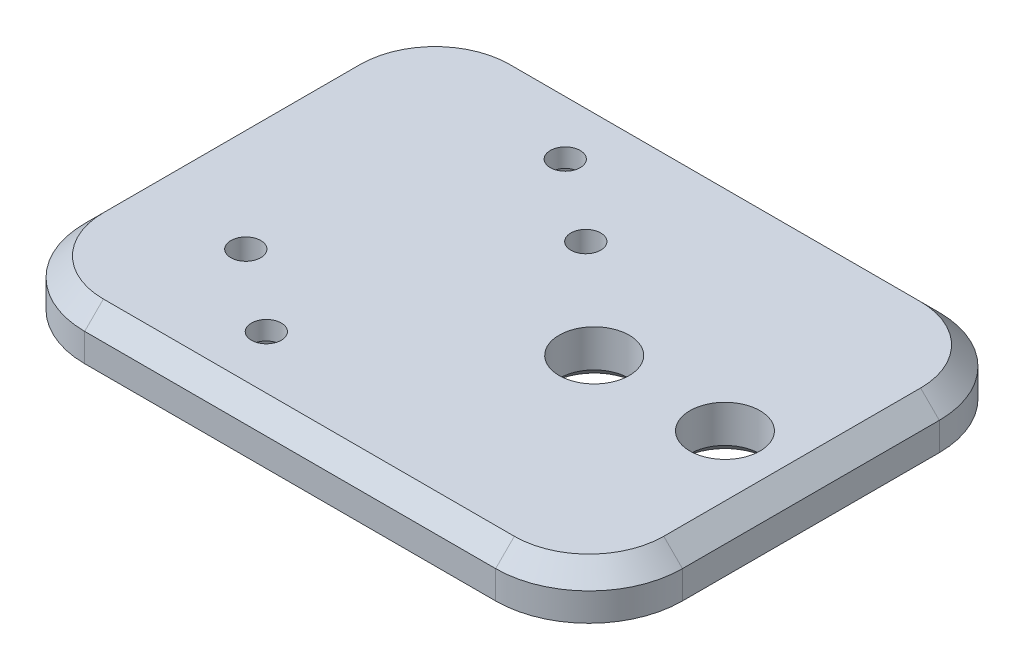
from build123d import *

# Parameters (mm, degrees)
SKETCH1_W           = 64
SKETCH1_H           = 47.5
SKETCH1_R           = 1.6
SKETCH1_R_2         = 3.75
BOSS_EXTRUDE1_DEPTH = 5
SKETCH2_R           = 1.6
CUT_EXTRUDE1_DEPTH  = 97.544548938
CUT_EXTRUDE2_DEPTH  = 3
FILLET1_R           = 10
FILLET2_R           = 10
CHAMFER1_SIZE       = 2
CHAMFER2_SIZE       = 1


with BuildPart() as part:
    # Sketch1 → Boss-Extrude1 (new body)
    with BuildSketch(Plane(origin=(0, 0, 0), x_dir=(1, 0, 0), z_dir=(0, 1, 0))):
        with Locations((-37.591918828, -42.97941453)):
            Rectangle(SKETCH1_W, SKETCH1_H)
        with Locations((-39.091918828, -33.57941453)):
            Circle(SKETCH1_R, mode=Mode.SUBTRACT)
        with Locations((-56.591918828, -52.47941453)):
            Circle(SKETCH1_R, mode=Mode.SUBTRACT)
        with Locations((-28.091918828, -43.67941453)):
            Circle(SKETCH1_R_2, mode=Mode.SUBTRACT)
        with Locations((-14.091918828, -43.67941453)):
            Circle(SKETCH1_R_2, mode=Mode.SUBTRACT)
    extrude(amount=BOSS_EXTRUDE1_DEPTH)

    # Sketch2 → Cut-Extrude1 (cut, through all)
    with BuildSketch(Plane.XZ):
        with Locations((-47.841918828, 59.02941453)):
            Circle(SKETCH2_R)
        with Locations((-47.841918828, 27.02941453)):
            Circle(SKETCH2_R)
    extrude(amount=-CUT_EXTRUDE1_DEPTH, mode=Mode.SUBTRACT)

    # Sketch3 → Cut-Extrude2 (cut)
    with BuildSketch(Plane(origin=(0, 0, 0), x_dir=(-1, 0, 0), z_dir=(0, -1, 0))):
        Polygon((49.429632069, -56.27941453), (46.254205588, -56.27941453), (44.666492348, -59.02941453), (46.254205588, -61.77941453), (49.429632069, -61.77941453), (51.017345309, -59.02941453), align=None)
        Polygon((46.254205588, -29.77941453), (49.429632069, -29.77941453), (51.017345309, -27.02941453), (49.429632069, -24.27941453), (46.254205588, -24.27941453), (44.666492348, -27.02941453), align=None)
    extrude(amount=-CUT_EXTRUDE2_DEPTH, mode=Mode.SUBTRACT)

    # Fillet1
    fillet1_edges = [part.edges().sort_by_distance(p)[0] for p in [
        (-5.591918828, 2.5, 19.22941453),
        (-69.591918828, 2.5, 19.22941453),
    ]]
    fillet(fillet1_edges, radius=FILLET1_R)

    # Fillet2
    fillet2_edges = [part.edges().sort_by_distance(p)[0] for p in [
        (-5.591918828, 2.5, 66.72941453),
        (-69.591918828, 2.5, 66.72941453),
    ]]
    fillet(fillet2_edges, radius=FILLET2_R)

    # Chamfer1
    chamfer1_edges = [part.edges().sort_by_distance(p)[0] for p in [
        (-5.591918828, 5, 42.97941453),
        (-69.591918828, 5, 42.97941453),
        (-8.520851016, 5, 22.158346718),
        (-66.66298664, 5, 22.158346718),
        (-37.591918828, 5, 19.22941453),
        (-37.591918828, 5, 66.72941453),
        (-8.520851016, 5, 63.800482342),
        (-66.66298664, 5, 63.800482342),
    ]]
    chamfer(chamfer1_edges, length=CHAMFER1_SIZE)

    # Chamfer2
    chamfer2_edges = [part.edges().sort_by_distance(p)[0] for p in [
        (-31.841918828, 0, 43.67941453),
        (-17.841918828, 0, 43.67941453),
    ]]
    chamfer(chamfer2_edges, length=CHAMFER2_SIZE)


solid = part.part
